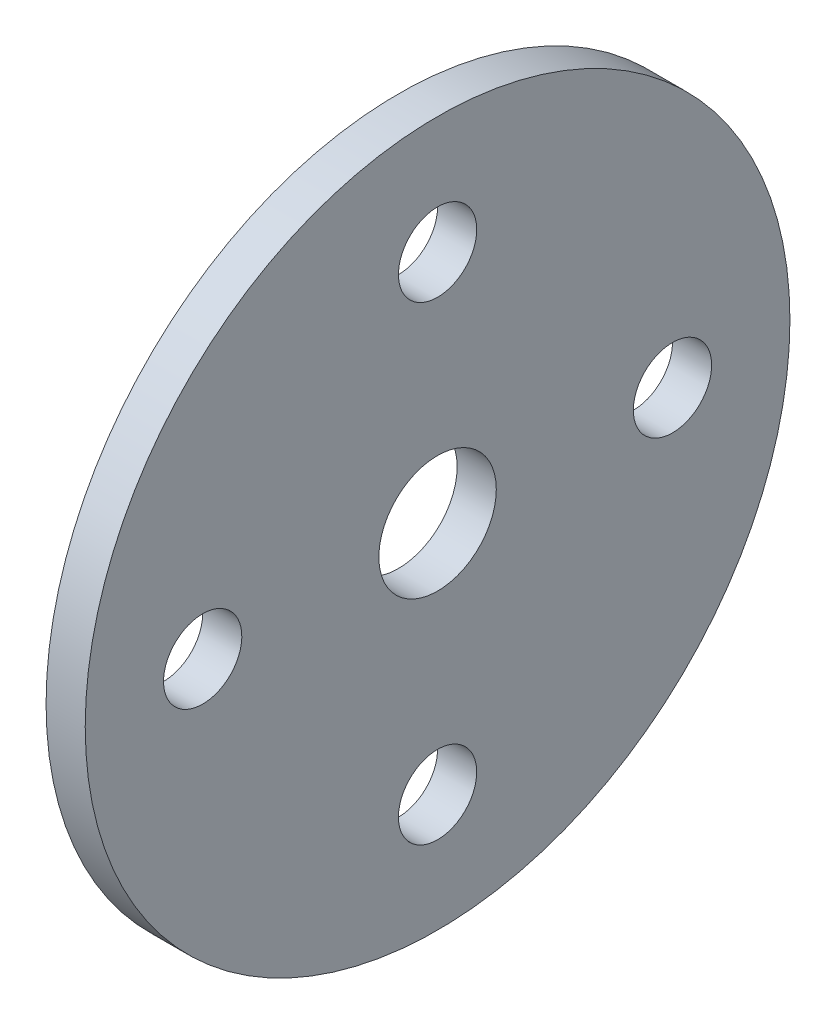
from build123d import *

# Parameters (mm, degrees)
SKETCH1_R           = 28.575
SKETCH1_R_2         = 4.7625
BOSS_EXTRUDE1_DEPTH = 3.175
SKETCH2_R           = 3.175
CUT_EXTRUDE1_DEPTH  = 41.535686438
CIRPATTERN1_COUNT   = 4


with BuildPart() as part:
    # Sketch1 → Boss-Extrude1 (new body)
    with BuildSketch(Plane(origin=(0, 0, 0), x_dir=(0, 0, -1), z_dir=(1, 0, 0))):
        Circle(SKETCH1_R)
        Circle(SKETCH1_R_2, mode=Mode.SUBTRACT)
    extrude(amount=BOSS_EXTRUDE1_DEPTH)

    # Sketch2 → Cut-Extrude1 (cut, through all)
    with BuildSketch(Plane(origin=(0, 0, 0), x_dir=(0, 0, -1), z_dir=(1, 0, 0))):
        with Locations((0, 19.05)):
            Circle(SKETCH2_R)
    cut_extrude1 = extrude(amount=CUT_EXTRUDE1_DEPTH, mode=Mode.SUBTRACT)

    # CirPattern1: Cut-Extrude1 ×4 about axis
    cirpattern1_axis = Axis((3.175, 0, 0), (1, 0, 0))
    for i in range(1, CIRPATTERN1_COUNT):
        add(cut_extrude1.rotate(cirpattern1_axis, i * 360 / CIRPATTERN1_COUNT), mode=Mode.SUBTRACT)


solid = part.part
